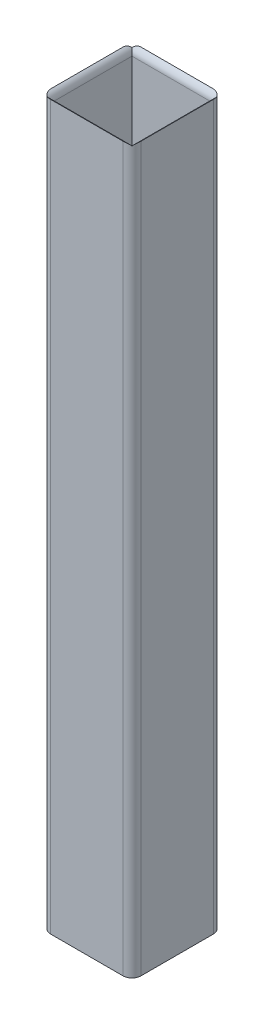
from build123d import *

# Parameters (mm, degrees)
SKETCH1_W           = 50
SKETCH1_H           = 400
BOSS_EXTRUDE1_DEPTH = 50
SKETCH2_W           = 45
SKETCH2_H           = 45
CUT_EXTRUDE1_DEPTH  = 407.201920232
FILLET1_R           = 5
FILLET2_R           = 5


with BuildPart() as part:
    # Sketch1 → Boss-Extrude1 (new body)
    with BuildSketch(Plane.XY):
        with Locations((25, 200)):
            Rectangle(SKETCH1_W, SKETCH1_H)
    extrude(amount=BOSS_EXTRUDE1_DEPTH)

    # Sketch2 → Cut-Extrude1 (cut, through all)
    with BuildSketch(Plane(origin=(0, 400, 0), x_dir=(1, 0, 0), z_dir=(0, 1, 0))):
        with Locations((25, -25)):
            Rectangle(SKETCH2_W, SKETCH2_H)
    extrude(amount=-CUT_EXTRUDE1_DEPTH, mode=Mode.SUBTRACT)

    # Fillet1
    fillet1_edges = [part.edges().sort_by_distance(p)[0] for p in [
        (50, 200, 50),
        (0, 200, 50),
        (50, 200, 0),
        (0, 200, 0),
    ]]
    fillet(fillet1_edges, radius=FILLET1_R)

    # Fillet2
    # the kernel refuses this fillet: 5 mm, written as the material it takes off along each edge
    with BuildSketch(Plane(origin=(47.5, 400, 2.5), x_dir=(0, -1, 0), z_dir=(0, 0, 1)), Plane(origin=(47.5, 400, 47.5), x_dir=(0, -1, 0), z_dir=(-1, 0, 0)), Plane(origin=(2.5, 400, 47.5), x_dir=(0, -1, 0), z_dir=(0, 0, -1)), Plane(origin=(2.5, 400, 2.5), x_dir=(0, -1, 0), z_dir=(1, 0, 0))) as fillet2_piece_1:
        with BuildLine():
            CenterArc((FILLET2_R, FILLET2_R), FILLET2_R, 180, 90)
            Line((0, FILLET2_R), (-FILLET2_R * 0.02, FILLET2_R))
            Line((-FILLET2_R * 0.02, FILLET2_R), (-FILLET2_R * 0.02, -FILLET2_R * 0.02))
            Line((-FILLET2_R * 0.02, -FILLET2_R * 0.02), (FILLET2_R, -FILLET2_R * 0.02))
            Line((FILLET2_R, -FILLET2_R * 0.02), (FILLET2_R, 0))
        make_face()
    extrude(amount=45, mode=Mode.SUBTRACT)
    with BuildSketch(Plane(origin=(47.5, 400, -10), x_dir=(0, -1, 0), z_dir=(0, 0, 1))) as fillet2_piece_2a_section:
        with BuildLine():
            CenterArc((FILLET2_R, FILLET2_R), FILLET2_R, 180, 90)
            Line((0, FILLET2_R), (-FILLET2_R * 0.02, FILLET2_R))
            Line((-FILLET2_R * 0.02, FILLET2_R), (-FILLET2_R * 0.02, -FILLET2_R * 0.02))
            Line((-FILLET2_R * 0.02, -FILLET2_R * 0.02), (FILLET2_R, -FILLET2_R * 0.02))
            Line((FILLET2_R, -FILLET2_R * 0.02), (FILLET2_R, 0))
        make_face()
    fillet2_piece_2a = extrude(amount=57.5, mode=Mode.PRIVATE)
    fillet2_piece_2a = split(fillet2_piece_2a, bisect_by=Plane(origin=(48.631975571, 398.868024429, 2.5), z_dir=(0, 0, -1)), keep=Keep.TOP, mode=Mode.PRIVATE)
    with BuildSketch(Plane(origin=(2.5, 400, 2.5), x_dir=(0, -1, 0), z_dir=(1, 0, 0))) as fillet2_piece_2b_section:
        with BuildLine():
            CenterArc((FILLET2_R, FILLET2_R), FILLET2_R, 180, 90)
            Line((0, FILLET2_R), (-FILLET2_R * 0.02, FILLET2_R))
            Line((-FILLET2_R * 0.02, FILLET2_R), (-FILLET2_R * 0.02, -FILLET2_R * 0.02))
            Line((-FILLET2_R * 0.02, -FILLET2_R * 0.02), (FILLET2_R, -FILLET2_R * 0.02))
            Line((FILLET2_R, -FILLET2_R * 0.02), (FILLET2_R, 0))
        make_face()
    fillet2_piece_2b = extrude(amount=57.5, mode=Mode.PRIVATE)
    fillet2_piece_2b = split(fillet2_piece_2b, bisect_by=Plane(origin=(47.5, 398.868024429, 1.368024429), z_dir=(1, 0, 0)), keep=Keep.TOP, mode=Mode.PRIVATE)
    fillet2_piece_2 = fillet2_piece_2a & fillet2_piece_2b
    add(fillet2_piece_2, mode=Mode.SUBTRACT)
    with BuildSketch(Plane(origin=(60, 400, 47.5), x_dir=(0, -1, 0), z_dir=(-1, 0, 0))) as fillet2_piece_3a_section:
        with BuildLine():
            CenterArc((FILLET2_R, FILLET2_R), FILLET2_R, 180, 90)
            Line((0, FILLET2_R), (-FILLET2_R * 0.02, FILLET2_R))
            Line((-FILLET2_R * 0.02, FILLET2_R), (-FILLET2_R * 0.02, -FILLET2_R * 0.02))
            Line((-FILLET2_R * 0.02, -FILLET2_R * 0.02), (FILLET2_R, -FILLET2_R * 0.02))
            Line((FILLET2_R, -FILLET2_R * 0.02), (FILLET2_R, 0))
        make_face()
    fillet2_piece_3a = extrude(amount=57.5, mode=Mode.PRIVATE)
    fillet2_piece_3a = split(fillet2_piece_3a, bisect_by=Plane(origin=(47.5, 398.868024429, 48.631975571), z_dir=(1, 0, 0)), keep=Keep.TOP, mode=Mode.PRIVATE)
    with BuildSketch(Plane(origin=(47.5, 400, 2.5), x_dir=(0, -1, 0), z_dir=(0, 0, 1))) as fillet2_piece_3b_section:
        with BuildLine():
            CenterArc((FILLET2_R, FILLET2_R), FILLET2_R, 180, 90)
            Line((0, FILLET2_R), (-FILLET2_R * 0.02, FILLET2_R))
            Line((-FILLET2_R * 0.02, FILLET2_R), (-FILLET2_R * 0.02, -FILLET2_R * 0.02))
            Line((-FILLET2_R * 0.02, -FILLET2_R * 0.02), (FILLET2_R, -FILLET2_R * 0.02))
            Line((FILLET2_R, -FILLET2_R * 0.02), (FILLET2_R, 0))
        make_face()
    fillet2_piece_3b = extrude(amount=57.5, mode=Mode.PRIVATE)
    fillet2_piece_3b = split(fillet2_piece_3b, bisect_by=Plane(origin=(48.631975571, 398.868024429, 47.5), z_dir=(0, 0, 1)), keep=Keep.TOP, mode=Mode.PRIVATE)
    fillet2_piece_3 = fillet2_piece_3a & fillet2_piece_3b
    add(fillet2_piece_3, mode=Mode.SUBTRACT)
    with BuildSketch(Plane(origin=(2.5, 400, 60), x_dir=(0, -1, 0), z_dir=(0, 0, -1))) as fillet2_piece_4a_section:
        with BuildLine():
            CenterArc((FILLET2_R, FILLET2_R), FILLET2_R, 180, 90)
            Line((0, FILLET2_R), (-FILLET2_R * 0.02, FILLET2_R))
            Line((-FILLET2_R * 0.02, FILLET2_R), (-FILLET2_R * 0.02, -FILLET2_R * 0.02))
            Line((-FILLET2_R * 0.02, -FILLET2_R * 0.02), (FILLET2_R, -FILLET2_R * 0.02))
            Line((FILLET2_R, -FILLET2_R * 0.02), (FILLET2_R, 0))
        make_face()
    fillet2_piece_4a = extrude(amount=57.5, mode=Mode.PRIVATE)
    fillet2_piece_4a = split(fillet2_piece_4a, bisect_by=Plane(origin=(1.368024429, 398.868024429, 47.5), z_dir=(0, 0, 1)), keep=Keep.TOP, mode=Mode.PRIVATE)
    with BuildSketch(Plane(origin=(47.5, 400, 47.5), x_dir=(0, -1, 0), z_dir=(-1, 0, 0))) as fillet2_piece_4b_section:
        with BuildLine():
            CenterArc((FILLET2_R, FILLET2_R), FILLET2_R, 180, 90)
            Line((0, FILLET2_R), (-FILLET2_R * 0.02, FILLET2_R))
            Line((-FILLET2_R * 0.02, FILLET2_R), (-FILLET2_R * 0.02, -FILLET2_R * 0.02))
            Line((-FILLET2_R * 0.02, -FILLET2_R * 0.02), (FILLET2_R, -FILLET2_R * 0.02))
            Line((FILLET2_R, -FILLET2_R * 0.02), (FILLET2_R, 0))
        make_face()
    fillet2_piece_4b = extrude(amount=57.5, mode=Mode.PRIVATE)
    fillet2_piece_4b = split(fillet2_piece_4b, bisect_by=Plane(origin=(2.5, 398.868024429, 48.631975571), z_dir=(-1, 0, 0)), keep=Keep.TOP, mode=Mode.PRIVATE)
    fillet2_piece_4 = fillet2_piece_4a & fillet2_piece_4b
    add(fillet2_piece_4, mode=Mode.SUBTRACT)
    with BuildSketch(Plane(origin=(2.5, 400, 47.5), x_dir=(0, -1, 0), z_dir=(0, 0, -1))) as fillet2_piece_5a_section:
        with BuildLine():
            CenterArc((FILLET2_R, FILLET2_R), FILLET2_R, 180, 90)
            Line((0, FILLET2_R), (-FILLET2_R * 0.02, FILLET2_R))
            Line((-FILLET2_R * 0.02, FILLET2_R), (-FILLET2_R * 0.02, -FILLET2_R * 0.02))
            Line((-FILLET2_R * 0.02, -FILLET2_R * 0.02), (FILLET2_R, -FILLET2_R * 0.02))
            Line((FILLET2_R, -FILLET2_R * 0.02), (FILLET2_R, 0))
        make_face()
    fillet2_piece_5a = extrude(amount=57.5, mode=Mode.PRIVATE)
    fillet2_piece_5a = split(fillet2_piece_5a, bisect_by=Plane(origin=(1.368024429, 398.868024429, 2.5), z_dir=(0, 0, -1)), keep=Keep.TOP, mode=Mode.PRIVATE)
    with BuildSketch(Plane(origin=(-10, 400, 2.5), x_dir=(0, -1, 0), z_dir=(1, 0, 0))) as fillet2_piece_5b_section:
        with BuildLine():
            CenterArc((FILLET2_R, FILLET2_R), FILLET2_R, 180, 90)
            Line((0, FILLET2_R), (-FILLET2_R * 0.02, FILLET2_R))
            Line((-FILLET2_R * 0.02, FILLET2_R), (-FILLET2_R * 0.02, -FILLET2_R * 0.02))
            Line((-FILLET2_R * 0.02, -FILLET2_R * 0.02), (FILLET2_R, -FILLET2_R * 0.02))
            Line((FILLET2_R, -FILLET2_R * 0.02), (FILLET2_R, 0))
        make_face()
    fillet2_piece_5b = extrude(amount=57.5, mode=Mode.PRIVATE)
    fillet2_piece_5b = split(fillet2_piece_5b, bisect_by=Plane(origin=(2.5, 398.868024429, 1.368024429), z_dir=(-1, 0, 0)), keep=Keep.TOP, mode=Mode.PRIVATE)
    fillet2_piece_5 = fillet2_piece_5a & fillet2_piece_5b
    add(fillet2_piece_5, mode=Mode.SUBTRACT)


solid = part.part
